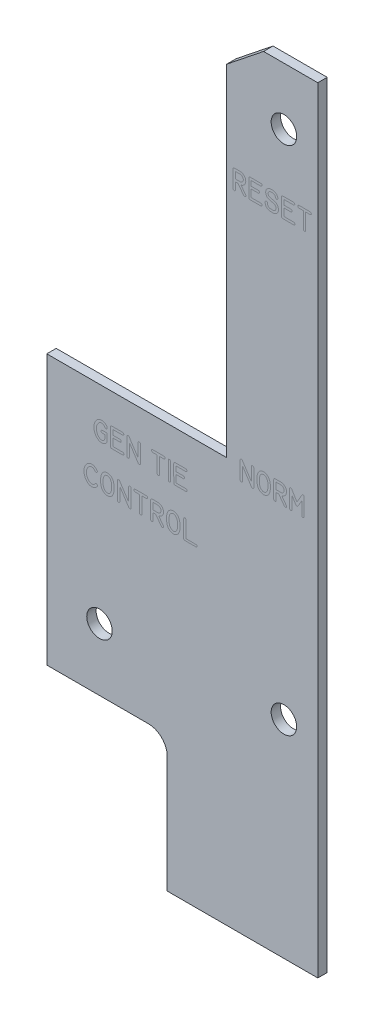
from build123d import *

# Parameters (mm, degrees)
BOSS_EXTRUDE1_DEPTH = 1.5875
SKETCH4_R           = 2.15265
CUT_EXTRUDE1_DEPTH  = 139.578839136


with BuildPart() as part:
    # Sketch1 → Boss-Extrude1 (new body)
    with BuildSketch(Plane.XY):
        with BuildLine():
            Line((-15.392138512, 125.820167161), (-15.392138512, 68.343175012))
            Line((-15.392138512, 68.343175012), (-45.72, 68.343175012))
            Line((-45.72, 68.343175012), (-45.72, 22.86))
            Line((-45.72, 22.86), (-28.575, 22.86))
            ThreePointArc((-28.575, 22.86), (-26.32993597, 21.93006403), (-25.4, 19.685))
            Line((-25.4, 19.685), (-25.4, 0))
            Line((-25.4, 0), (0, 0))
            Line((0, 0), (0, 130.81))
            Line((0, 130.81), (-9.144, 130.81))
            Line((-9.144, 130.81), (-15.392138512, 125.820167161))
        make_face()
    extrude(amount=BOSS_EXTRUDE1_DEPTH)

    # Sketch4 → Cut-Extrude1 (cut, through all)
    with BuildSketch(Plane(origin=(0, 0, 0), x_dir=(-1, 0, 0), z_dir=(0, 0, -1))):
        with Locations((5.715, 121.158)):
            Circle(SKETCH4_R)
        with Locations((5.715, 34.925)):
            Circle(SKETCH4_R)
        with Locations((36.83, 33.3375)):
            Circle(SKETCH4_R)
    extrude(amount=-CUT_EXTRUDE1_DEPTH, mode=Mode.SUBTRACT)


solid = part.part
